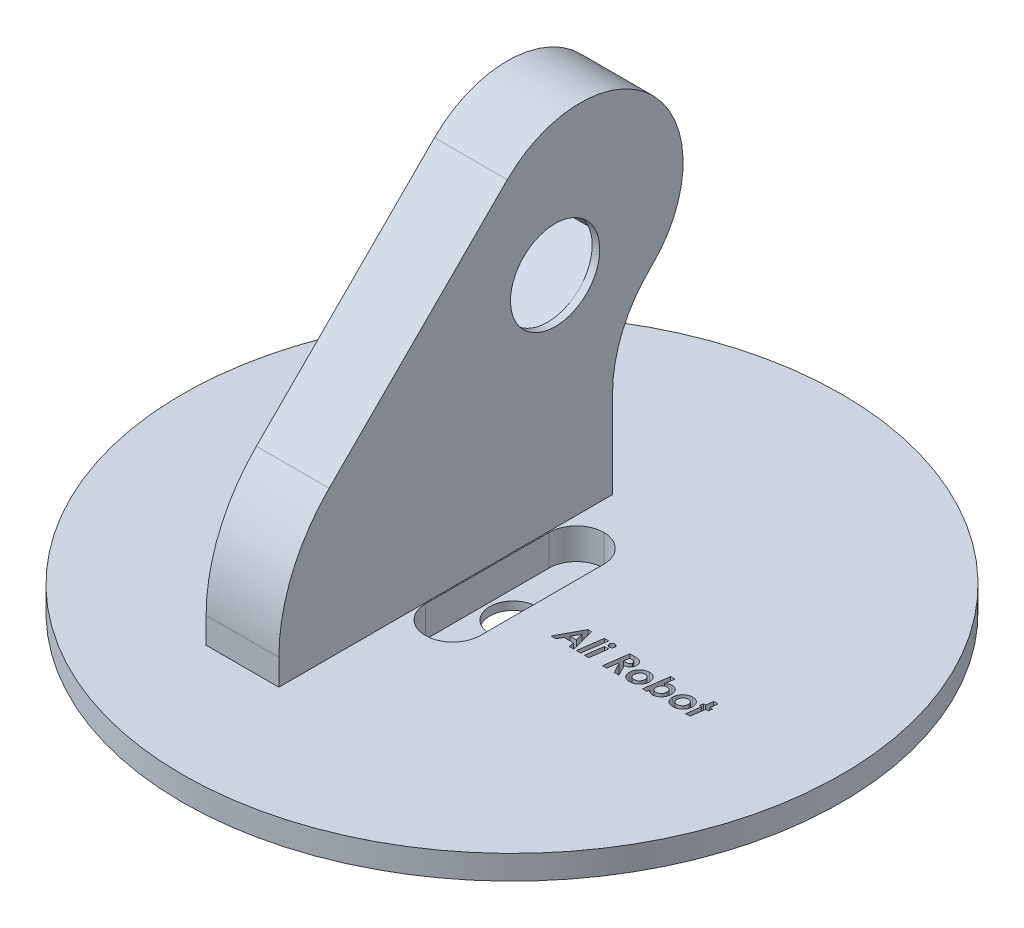
from build123d import *

# Parameters (mm, degrees)
SKETCH2_R           = 48
BOSS_EXTRUDE1_DEPTH = 3.5
BOSS_EXTRUDE2_DEPTH = 10.6
SKETCH31_R          = 6.5
CUT_EXTRUDE18_DEPTH = 94.671540859
CUT_EXTRUDE19_DEPTH = 9.5
SKETCH32_R          = 1
CUT_EXTRUDE20_DEPTH = 4.5
SKETCH33_R          = 42.5
BOSS_EXTRUDE3_DEPTH = 2.2
SKETCH34_W          = 8
SKETCH34_H          = 26
CUT_EXTRUDE21_DEPTH = 4.5
SKETCH35_R          = 3.43
CUT_EXTRUDE22_DEPTH = 136.699421377
FILLET1_R           = 4
SKETCH36_R          = 1
CUT_EXTRUDE23_DEPTH = 4.5
CUT_EXTRUDE24_DEPTH = 3


with BuildPart() as part:
    # Sketch2 → Boss-Extrude1 (new body)
    with BuildSketch(Plane(origin=(0, 0, 0), x_dir=(1, 0, 0), z_dir=(0, 1, 0))):
        with Locations(Location((0, 0, 0), (0, 0, 270))):
            Circle(SKETCH2_R)
    extrude(amount=BOSS_EXTRUDE1_DEPTH)

    # Sketch7 → Boss-Extrude2 (add)
    with BuildSketch(Plane(origin=(-4, 0, 0), x_dir=(0, 0, -1), z_dir=(1, 0, 0))):
        with BuildLine():
            Line((18.652115716, 3.5), (18.652115716, 16.356133126))
            ThreePointArc((18.652115716, 16.356133126), (20.111216245, 23.455333411), (24.251965127, 29.403595153))
            ThreePointArc((24.251965127, 29.403595153), (24.659117989, 50.747356958), (3.311904584, 50.883081894))
            Line((3.311904584, 50.883081894), (-22.631121669, 24.94005564))
            ThreePointArc((-22.631121669, 24.94005564), (-28.050440452, 16.82947192), (-29.95345214, 7.262386111))
            Line((-29.95345214, 7.262386111), (-29.95345214, 3.5))
            Line((-29.95345214, 3.5), (18.652115716, 3.5))
        make_face()
    extrude(amount=-BOSS_EXTRUDE2_DEPTH)

    # Sketch31 → Cut-Extrude18 (cut, through all)
    with BuildSketch(Plane(origin=(-14.6, 10.461755651, -5.359516796), x_dir=(0, 0, 1), z_dir=(-1, 0, 0))):
        with Locations((-4.922469695, 24.905412087)):
            Circle(SKETCH31_R)
    extrude(amount=-CUT_EXTRUDE18_DEPTH, mode=Mode.SUBTRACT)

    # Sketch31<3> → Cut-Extrude19 (cut)
    with BuildSketch(Plane(origin=(-14.6, 10.461755651, -5.359516796), x_dir=(0, 0, 1), z_dir=(-1, 0, 0))):
        Polygon((-5.41546104, 34.054639751), (11.74960782, 18.74580534), (3.09678837, 9.043809897), (-14.06828049, 24.352644308), align=None)
    extrude(amount=-CUT_EXTRUDE19_DEPTH, mode=Mode.SUBTRACT)

    # Sketch32 → Cut-Extrude20 (cut)
    with BuildSketch(Plane.ZY.offset(14.6)):
        with Locations((-17.080620038, 41.264504586)):
            Circle(SKETCH32_R)
        with Locations((3.929449654, 22.692559529)):
            Circle(SKETCH32_R)
    extrude(amount=-CUT_EXTRUDE20_DEPTH, mode=Mode.SUBTRACT)

    # Sketch33 → Boss-Extrude3 (add)
    with BuildSketch(Plane.XZ):
        with Locations(Location((0, 0, 0), (0, 0, 270))):
            Circle(SKETCH33_R)
    extrude(amount=BOSS_EXTRUDE3_DEPTH)

    # Sketch34 → Cut-Extrude21 (cut)
    with BuildSketch(Plane(origin=(-3.933328665, 3.5, 15.113921586), x_dir=(1, 0, 0), z_dir=(0, 1, 0))):
        with Locations((4.080604154, 15.353143489)):
            Rectangle(SKETCH34_W, SKETCH34_H)
    extrude(amount=-CUT_EXTRUDE21_DEPTH, mode=Mode.SUBTRACT)

    # Sketch35 → Cut-Extrude22 (cut, through all)
    with BuildSketch(Plane(origin=(64.920383929, 3.5, -6.612415768), x_dir=(1, 0, 0), z_dir=(0, 1, 0))):
        with Locations(Location((-64.816151671, -6.541004949, 0), (0, 0, 270))):
            Circle(SKETCH35_R)
    extrude(amount=-CUT_EXTRUDE22_DEPTH, mode=Mode.SUBTRACT)

    # Fillet1
    fillet1_edges = [part.edges().sort_by_distance(p)[0] for p in [
        (4.147275489, 1.25, 12.760778097),
        (-3.852724511, 1.25, 12.760778097),
        (4.147275489, 1.25, -13.239221903),
        (-3.852724511, 1.25, -13.239221903),
    ]]
    fillet(fillet1_edges, radius=FILLET1_R - 0.0001)  # a hair under: the kernel refuses the full size

    # Sketch36 → Cut-Extrude23 (cut)
    with BuildSketch(Plane(origin=(-0.364876774, -1, -0.231577183), x_dir=(1, 0, 0), z_dir=(0, 1, 0))):
        with Locations(Location((0.999824919, 5.746037209, 0), (0, 0, 270))):
            Circle(SKETCH36_R)
        with Locations(Location((0.996583401, -6.066660315, 0), (0, 0, 270))):
            Circle(SKETCH36_R)
    extrude(amount=-CUT_EXTRUDE23_DEPTH, mode=Mode.SUBTRACT)

    # Sketch38 → Cut-Extrude24 (cut)
    # profile 1 of 9: a face of its own
    with BuildSketch(Plane(origin=(0, 3.5, 0), x_dir=(1, 0, 0), z_dir=(0, 1, 0))):
        Polygon((11.234213374, -0.170104505), (11.785295104, -0.170104505), (12.673616419, -3.670104505), (12.027182124, -3.670104505), (11.833672508, -2.907283992), (10.469289496, -2.907283992), (10.059834367, -3.670104505), (9.353103598, -3.670104505), align=None)
        Polygon((11.684333566, -2.323950659), (11.395471387, -1.184627742), (10.78339206, -2.323950659), align=None, mode=Mode.SUBTRACT)
    # profile 2 of 9: a face of its own
    with BuildSketch(Plane(origin=(0, 3.5, 0), x_dir=(1, 0, 0), z_dir=(0, 1, 0))):
        Polygon((13.535996226, -0.080360915), (14.169810329, -0.080360915), (13.66640488, -3.670104505), (13.032590778, -3.670104505), align=None)
    # profile 3 of 9: a face of its own
    with BuildSketch(Plane(origin=(0, 3.5, 0), x_dir=(1, 0, 0), z_dir=(0, 1, 0))):
        with BuildLine():
            add(Edge.make_bspline(
                [(15.006949752, -0.03548912), (15.033724236, -0.037050399), (15.086317182, -0.040117209), (15.162584245, -0.062149233), (15.231434376, -0.101556531), (15.293403814, -0.152881213), (15.344728495, -0.21485065), (15.384135793, -0.283700781), (15.406167817, -0.359967844), (15.409234627, -0.41256079), (15.410795906, -0.439335274)],
                knots=[0, 0, 0, 0, 1.014134371, 1.992057583, 2.975098753, 4, 5.024901247, 6.007942417, 6.985865629, 8, 8, 8, 8], degree=3))
            add(Edge.make_bspline(
                [(15.410795906, -0.439335274), (15.409245272, -0.466115808), (15.406199373, -0.518720637), (15.383956784, -0.595099209), (15.344970591, -0.664433822), (15.29334378, -0.726417249), (15.231646153, -0.777958507), (15.162369408, -0.816365475), (15.086344614, -0.83860223), (15.03373349, -0.841636642), (15.006949752, -0.843181428)],
                knots=[0, 0, 0, 0, 1.013694729, 1.991193998, 2.981551723, 4.006008661, 5.030465598, 6.008806002, 6.986305271, 8, 8, 8, 8], degree=3))
            add(Edge.make_bspline(
                [(15.006949752, -0.843181428), (14.980160104, -0.841647208), (14.927537372, -0.83863355), (14.85139842, -0.816186723), (14.781641719, -0.77820039), (14.719927005, -0.726358021), (14.668084636, -0.664643307), (14.630098303, -0.594886606), (14.607651476, -0.518747654), (14.604637818, -0.466124922), (14.603103598, -0.439335274)],
                knots=[0, 0, 0, 0, 1.01324697, 1.990314468, 2.975995575, 4, 5.024004425, 6.009685532, 6.98675303, 8, 8, 8, 8], degree=3))
            add(Edge.make_bspline(
                [(14.603103598, -0.439335274), (14.604648384, -0.412551536), (14.607682796, -0.359940413), (14.629919552, -0.283915618), (14.668326519, -0.214638873), (14.719867777, -0.152941246), (14.781851204, -0.101314435), (14.851185818, -0.062328242), (14.927564389, -0.040085653), (14.980169218, -0.037039754), (15.006949752, -0.03548912)],
                knots=[0, 0, 0, 0, 1.013694729, 1.991193998, 2.969534402, 3.993991339, 5.018448277, 6.008806002, 6.986305271, 8, 8, 8, 8], degree=3))
        make_face()
    # profile 4 of 9: a face of its own
    with BuildSketch(Plane(origin=(0, 3.5, 0), x_dir=(1, 0, 0), z_dir=(0, 1, 0))):
        Polygon((14.562438534, -1.112412197), (15.196252637, -1.112412197), (14.833071547, -3.670104505), (14.199257444, -3.670104505), align=None)
    # profile 5 of 9: a face of its own
    with BuildSketch(Plane(origin=(0, 3.5, 0), x_dir=(1, 0, 0), z_dir=(0, 1, 0))):
        with BuildLine():
            Line((17.337478598, -0.170104505), (17.945351194, -0.170104505))
            add(Edge.make_bspline(
                [(17.945351194, -0.170104505), (17.990461912, -0.170288853), (18.0774408, -0.170644298), (18.20251927, -0.175698725), (18.317320027, -0.183324297), (18.421706567, -0.19338775), (18.515766042, -0.207350229), (18.599302851, -0.224114981), (18.672850562, -0.242784868), (18.716956864, -0.260134145), (18.737618822, -0.268261556)],
                knots=[0, 0, 0, 0, 1.348808202, 2.600664361, 3.742342956, 4.788858012, 5.735658768, 6.584006912, 7.336666444, 8, 8, 8, 8], degree=3))
            add(Edge.make_bspline(
                [(18.737618822, -0.268261556), (18.760881531, -0.278751926), (18.806356444, -0.29925894), (18.871519344, -0.334019586), (18.932539327, -0.371466236), (18.988405098, -0.413010751), (19.040295597, -0.456903826), (19.087889056, -0.503562941), (19.130802248, -0.55370417), (19.169485538, -0.606428163), (19.203882551, -0.661666729), (19.233408844, -0.719692265), (19.258939718, -0.780013512), (19.278877214, -0.843286871), (19.29544767, -0.908752815), (19.30616484, -0.97682439), (19.313707078, -1.04727198), (19.314326819, -1.095096686), (19.31464206, -1.119423415)],
                knots=[0, 0, 0, 0, 1.116361014, 2.182309107, 3.229450697, 4.24598407, 5.225421932, 6.201651319, 7.158895679, 8.110002388, 9.060669178, 10.002827475, 10.956240434, 11.923213192, 12.902917952, 13.908279153, 14.936015885, 16, 16, 16, 16], degree=3))
            add(Edge.make_bspline(
                [(19.31464206, -1.119423415), (19.313900694, -1.14935913), (19.312437117, -1.208457078), (19.302873802, -1.295604951), (19.285037031, -1.379232383), (19.261016279, -1.459602808), (19.231256497, -1.537236615), (19.192877363, -1.610782918), (19.148515858, -1.681523171), (19.097282847, -1.748529924), (19.040017621, -1.812417855), (18.973896349, -1.869427088), (18.902576953, -1.923391655), (18.823129531, -1.97069347), (18.737739084, -2.014632643), (18.644457977, -2.051860582), (18.545036949, -2.086216223), (18.475324737, -2.103410743), (18.43964206, -2.112211877)],
                knots=[0, 0, 0, 0, 0.995453645, 1.965186658, 2.910129054, 3.83459069, 4.752398018, 5.669942118, 6.588407184, 7.525617038, 8.471772905, 9.435289717, 10.423772802, 11.441988612, 12.505459691, 13.613754905, 14.778583949, 16, 16, 16, 16], degree=3))
            Line((18.43964206, -2.112211877), (19.247334367, -3.670104505))
            Line((19.247334367, -3.670104505), (18.545511451, -3.670104505))
            Line((18.545511451, -3.670104505), (17.754646066, -2.144463479))
            Line((17.754646066, -2.144463479), (17.695050713, -2.144463479))
            Line((17.695050713, -2.144463479), (17.480507444, -3.670104505))
            Line((17.480507444, -3.670104505), (16.846693342, -3.670104505))
            Line((16.846693342, -3.670104505), (17.337478598, -0.170104505))
        make_face()
        with BuildLine():
            add(Edge.make_bspline(
                [(17.777081963, -1.561130146), (17.822194038, -1.560711256), (17.908482086, -1.559910025), (18.031718476, -1.554336883), (18.14284927, -1.545533343), (18.241553965, -1.532952509), (18.328092207, -1.518073936), (18.40209638, -1.499499099), (18.463905682, -1.477413957), (18.514495006, -1.451223183), (18.555475842, -1.42047266), (18.590946517, -1.387657032), (18.620482235, -1.350923569), (18.644851849, -1.31088895), (18.66364733, -1.267470195), (18.677201777, -1.220373146), (18.684696139, -1.16991183), (18.685848236, -1.135105351), (18.686436931, -1.11732005)],
                knots=[0, 0, 0, 0, 1.892208387, 3.619318591, 5.173427176, 6.566868293, 7.791773198, 8.8545744, 9.763297566, 10.539470204, 11.233547833, 11.906251103, 12.5615143, 13.203742025, 13.866659999, 14.539934446, 15.25394049, 16, 16, 16, 16], degree=3))
            add(Edge.make_bspline(
                [(18.686436931, -1.11732005), (18.685674889, -1.097154087), (18.68419663, -1.058034883), (18.671410296, -1.001691948), (18.649546106, -0.950581254), (18.618818966, -0.905191441), (18.580473147, -0.865168951), (18.53369335, -0.832205814), (18.479014112, -0.806257483), (18.427792709, -0.789114207), (18.379308966, -0.779184383), (18.334112776, -0.772512871), (18.280601749, -0.7660751), (18.218614928, -0.761314571), (18.148226827, -0.75816557), (18.069473284, -0.755105638), (17.982513177, -0.754017509), (17.921746603, -0.753636911), (17.889962572, -0.753437838)],
                knots=[0, 0, 0, 0, 0.974340854, 1.890087692, 2.776057671, 3.647490651, 4.526730822, 5.442477659, 6.397820337, 7.445016909, 8.045730266, 8.789007992, 9.653967296, 10.651691253, 11.794598421, 13.061237498, 14.462876682, 16, 16, 16, 16], degree=3))
            Line((17.889962572, -0.753437838), (17.777081963, -1.561130146))
        make_face(mode=Mode.SUBTRACT)
    # profile 6 of 9: a face of its own
    with BuildSketch(Plane(origin=(0, 3.5, 0), x_dir=(1, 0, 0), z_dir=(0, 1, 0))):
        with BuildLine():
            add(Edge.make_bspline(
                [(21.10390488, -1.067540402), (21.132205676, -1.067801263), (21.188216739, -1.068317542), (21.271251688, -1.076791941), (21.352561402, -1.088283547), (21.431755309, -1.105087467), (21.508763418, -1.127042832), (21.583911738, -1.1537877), (21.657385991, -1.185052775), (21.728169586, -1.221737771), (21.79620025, -1.2622808), (21.860854534, -1.306994684), (21.921055687, -1.356524279), (21.978491813, -1.408937638), (22.030743266, -1.466611664), (22.079230459, -1.527904512), (22.124539495, -1.592781526), (22.16560308, -1.661642395), (22.201764854, -1.734065485), (22.234420935, -1.808192303), (22.261103392, -1.885165214), (22.28235286, -1.964249823), (22.30065848, -2.045266898), (22.311711934, -2.128584003), (22.320319088, -2.213929685), (22.32080558, -2.271576635), (22.321052316, -2.30081364)],
                knots=[0, 0, 0, 0, 1.048380346, 2.074885017, 3.090367486, 4.090964834, 5.072523792, 6.056029873, 7.045505985, 8.029469653, 9.008388104, 9.979110116, 10.939576094, 11.895736256, 12.858269977, 13.820062943, 14.790784955, 15.789017664, 16.788414625, 17.789274365, 18.789121639, 19.804049856, 20.823403653, 21.864603227, 22.916983403, 24, 24, 24, 24], degree=3))
            add(Edge.make_bspline(
                [(22.321052316, -2.30081364), (22.319619601, -2.349019816), (22.316797746, -2.443966047), (22.297012332, -2.583639323), (22.263197648, -2.71753656), (22.215858626, -2.846045115), (22.155304616, -2.969198555), (22.081284251, -3.087107245), (21.992933579, -3.198542586), (21.893318647, -3.303762939), (21.784010872, -3.400153265), (21.666804377, -3.484466244), (21.543203881, -3.555740679), (21.413517543, -3.614546208), (21.276800052, -3.659246415), (21.134065161, -3.691262002), (20.985073188, -3.711747396), (20.883586993, -3.71388631), (20.831869624, -3.7149763)],
                knots=[0, 0, 0, 0, 1.011104245, 1.991457176, 2.952197104, 3.902991464, 4.858928698, 5.826026836, 6.817568841, 7.837123857, 8.861887107, 9.870051414, 10.860623363, 11.850212162, 12.851715058, 13.872153699, 14.915649431, 16, 16, 16, 16], degree=3))
            add(Edge.make_bspline(
                [(20.831869624, -3.7149763), (20.787180608, -3.714153797), (20.699859256, -3.712546645), (20.572535065, -3.696510448), (20.451951023, -3.671832677), (20.338440225, -3.635615998), (20.231550643, -3.590365048), (20.131718852, -3.534302422), (20.038690652, -3.468474255), (19.954355691, -3.391708196), (19.877584733, -3.307755196), (19.811040754, -3.216412915), (19.75412752, -3.118885549), (19.708910665, -3.014632036), (19.672882858, -2.904560186), (19.647014793, -2.788376728), (19.631256388, -2.665832705), (19.629593856, -2.582011467), (19.628744624, -2.53919505)],
                knots=[0, 0, 0, 0, 1.130534475, 2.209039425, 3.242686211, 4.241648197, 5.219495055, 6.175504508, 7.134035888, 8.097337106, 9.056251676, 10.008649417, 10.952170628, 11.908308165, 12.879116703, 13.879338768, 14.916752852, 16, 16, 16, 16], degree=3))
            add(Edge.make_bspline(
                [(19.628744624, -2.53919505), (19.630129394, -2.487484152), (19.63285354, -2.385757449), (19.653222978, -2.236445943), (19.688511473, -2.094173346), (19.737255381, -1.958685096), (19.798811542, -1.829343138), (19.876295949, -1.707787872), (19.966196952, -1.592038304), (20.069660962, -1.485284387), (20.181690912, -1.387899142), (20.299281022, -1.301752877), (20.422559058, -1.230100692), (20.549460565, -1.169585046), (20.682121593, -1.124371206), (20.818625267, -1.091170449), (20.959799348, -1.070900032), (21.055460923, -1.068669809), (21.10390488, -1.067540402)],
                knots=[0, 0, 0, 0, 1.070407058, 2.105725986, 3.11260329, 4.099768105, 5.082273654, 6.071629737, 7.078227986, 8.111679688, 9.144009435, 10.148605521, 11.124500349, 12.092034995, 13.054511379, 14.020338642, 14.997480131, 16, 16, 16, 16], degree=3))
        make_face()
        with BuildLine():
            add(Edge.make_bspline(
                [(21.057630842, -1.650873736), (21.026269955, -1.651636447), (20.965150904, -1.653122889), (20.876302302, -1.665982872), (20.79304741, -1.686932574), (20.715073471, -1.716261753), (20.643419269, -1.755392612), (20.576507562, -1.801790198), (20.516281479, -1.857752454), (20.462012486, -1.920664044), (20.414176698, -1.988504559), (20.372137329, -2.058299005), (20.336555272, -2.129766087), (20.308269609, -2.202725024), (20.284359334, -2.276698707), (20.268472408, -2.352366514), (20.259260913, -2.429591807), (20.257725534, -2.481444774), (20.256949752, -2.507644569)],
                knots=[0, 0, 0, 0, 1.147646984, 2.236642535, 3.278363253, 4.285788599, 5.277283386, 6.259990092, 7.25913394, 8.278119336, 9.296601724, 10.294389209, 11.258634566, 12.215104854, 13.156804447, 14.101569642, 15.040778374, 16, 16, 16, 16], degree=3))
            add(Edge.make_bspline(
                [(20.256949752, -2.507644569), (20.257532631, -2.530566622), (20.258672044, -2.575374643), (20.26627562, -2.640906789), (20.279776611, -2.702779036), (20.297767954, -2.76144146), (20.321967792, -2.816579396), (20.351167991, -2.868405184), (20.386215923, -2.916407622), (20.424970871, -2.961466715), (20.469417067, -3.001175849), (20.516988562, -3.036297243), (20.568043814, -3.066353198), (20.623114972, -3.08986505), (20.681451247, -3.109062165), (20.743278336, -3.12217512), (20.808531786, -3.129982068), (20.853114676, -3.131078932), (20.876040297, -3.131642967)],
                knots=[0, 0, 0, 0, 1.110133544, 2.170088686, 3.189065258, 4.17351184, 5.136579884, 6.099647928, 7.048308506, 8.010844321, 8.972448026, 9.927769731, 10.871216919, 11.834284962, 12.822174017, 13.841150589, 14.889866456, 16, 16, 16, 16], degree=3))
            add(Edge.make_bspline(
                [(20.876040297, -3.131642967), (20.908327519, -3.13081147), (20.971260249, -3.129190756), (21.062683434, -3.117309576), (21.148088828, -3.097133982), (21.227451551, -3.068248614), (21.300688371, -3.030725324), (21.368699859, -2.985891305), (21.429944961, -2.931876311), (21.48509304, -2.870934664), (21.533550481, -2.804751067), (21.575853609, -2.735370924), (21.612525236, -2.664120492), (21.642112388, -2.59018004), (21.664496143, -2.514049921), (21.680676275, -2.435740061), (21.690718735, -2.355059531), (21.692133156, -2.300374861), (21.692847188, -2.272768768)],
                knots=[0, 0, 0, 0, 1.164111062, 2.269030304, 3.317651816, 4.322802953, 5.30652745, 6.278887004, 7.252451034, 8.242831511, 9.237327035, 10.205734188, 11.170614506, 12.123681709, 13.072978069, 14.028315502, 15.004647829, 16, 16, 16, 16], degree=3))
            add(Edge.make_bspline(
                [(21.692847188, -2.272768768), (21.692320588, -2.250308024), (21.691285496, -2.206158886), (21.68279286, -2.141566002), (21.668601759, -2.080413151), (21.649936064, -2.022074887), (21.624294897, -1.967648418), (21.59433855, -1.915645637), (21.557203679, -1.868141891), (21.516160513, -1.823345671), (21.47081675, -1.782623151), (21.42121727, -1.747521842), (21.368893834, -1.71708776), (21.312660418, -1.693288489), (21.253512837, -1.674378403), (21.19119306, -1.66009748), (21.125354829, -1.652631844), (21.080550835, -1.651468737), (21.057630842, -1.650873736)],
                knots=[0, 0, 0, 0, 1.079193067, 2.121276228, 3.123935011, 4.093589047, 5.058482656, 6.010079462, 6.971567708, 7.949254825, 8.927715837, 9.893916005, 10.864935156, 11.830939453, 12.821955205, 13.846519011, 14.898362312, 16, 16, 16, 16], degree=3))
        make_face(mode=Mode.SUBTRACT)
    # profile 7 of 9: a face of its own
    with BuildSketch(Plane(origin=(0, 3.5, 0), x_dir=(1, 0, 0), z_dir=(0, 1, 0))):
        with BuildLine():
            Line((23.313840778, -3.670104505), (22.680026675, -3.670104505))
            Line((22.680026675, -3.670104505), (23.183432124, -0.080360915))
            Line((23.183432124, -0.080360915), (23.816545104, -0.080360915))
            Line((23.816545104, -0.080360915), (23.62724222, -1.431422614))
            add(Edge.make_bspline(
                [(23.62724222, -1.431422614), (23.660177044, -1.399109951), (23.722878643, -1.337592827), (23.819913625, -1.257983779), (23.913193306, -1.193936975), (24.005187179, -1.145305221), (24.098742939, -1.110612562), (24.195640627, -1.085114674), (24.298223302, -1.070244068), (24.368279889, -1.068454853), (24.404085169, -1.067540402)],
                knots=[0, 0, 0, 0, 1.251006972, 2.381677804, 3.399685655, 4.315539795, 5.196231247, 6.100316428, 7.029089122, 8, 8, 8, 8], degree=3))
            add(Edge.make_bspline(
                [(24.404085169, -1.067540402), (24.445287674, -1.068485671), (24.525749337, -1.070331624), (24.643204002, -1.088646533), (24.754232376, -1.117047879), (24.859019208, -1.15696827), (24.956475295, -1.209814729), (25.048312142, -1.272826908), (25.132725115, -1.348770844), (25.209846362, -1.434799464), (25.27933836, -1.527884039), (25.33968521, -1.62604411), (25.392255494, -1.727123958), (25.434281606, -1.832633065), (25.466552847, -1.941835417), (25.48961194, -2.054416651), (25.504092748, -2.170730285), (25.505988174, -2.249589314), (25.506949752, -2.289595691)],
                knots=[0, 0, 0, 0, 1.074461769, 2.098245705, 3.093738161, 4.060957578, 5.015928931, 5.980202173, 6.960712075, 7.971130566, 8.990819314, 9.98765587, 10.975026468, 11.960285364, 12.946317818, 13.942631884, 14.956266082, 16, 16, 16, 16], degree=3))
            add(Edge.make_bspline(
                [(25.506949752, -2.289595691), (25.506485439, -2.320470332), (25.505561779, -2.381889453), (25.495813586, -2.473415201), (25.4813639, -2.564117418), (25.460305544, -2.653867108), (25.432779537, -2.742293146), (25.399567925, -2.82953584), (25.361221982, -2.915948082), (25.316298398, -3.000256141), (25.266843562, -3.082073165), (25.212840452, -3.159694669), (25.155387397, -3.233294504), (25.092786476, -3.301015233), (25.02655498, -3.364505202), (24.956494381, -3.423572461), (24.881754013, -3.47756321), (24.803840208, -3.527078419), (24.723179042, -3.57113124), (24.641359309, -3.609869553), (24.558288967, -3.6420021), (24.474837248, -3.668999362), (24.390386293, -3.689199505), (24.305160276, -3.703946802), (24.218975194, -3.713542499), (24.161054574, -3.714497878), (24.132049912, -3.7149763)],
                knots=[0, 0, 0, 0, 1.013451801, 2.016066107, 3.019062145, 4.027971124, 5.040172772, 6.057828882, 7.091818133, 8.14227902, 9.192543668, 10.229263228, 11.245616414, 12.255867067, 13.254567598, 14.256800029, 15.26222985, 16.27988596, 17.286164752, 18.278298122, 19.250221527, 20.208875209, 21.15628221, 22.098734397, 23.047911355, 24, 24, 24, 24], degree=3))
            add(Edge.make_bspline(
                [(24.132049912, -3.7149763), (24.093171265, -3.713587548), (24.016277583, -3.710840893), (23.903498917, -3.690228625), (23.79579298, -3.655262854), (23.693309546, -3.607746487), (23.597518856, -3.546982021), (23.511655579, -3.471759408), (23.432370037, -3.386507872), (23.389570427, -3.320715947), (23.367827156, -3.287292005)],
                knots=[0, 0, 0, 0, 1.017645626, 2.01268628, 2.989956243, 3.975524875, 4.963465289, 5.948444836, 6.95775873, 8, 8, 8, 8], degree=3))
            Line((23.367827156, -3.287292005), (23.313840778, -3.670104505))
        make_face()
        with BuildLine():
            add(Edge.make_bspline(
                [(24.265263053, -1.650873736), (24.228968933, -1.652102616), (24.158238745, -1.654497465), (24.055407816, -1.672667991), (23.960088703, -1.704745444), (23.871134011, -1.748066448), (23.790345373, -1.806273578), (23.715653776, -1.877031365), (23.649507263, -1.963123617), (23.590054465, -2.059494251), (23.541668223, -2.163617884), (23.505225164, -2.270612742), (23.483457468, -2.379392755), (23.480684848, -2.452396344), (23.479305521, -2.488714281)],
                knots=[0, 0, 0, 0, 1.020631644, 1.989012793, 2.92445932, 3.841689372, 4.76099003, 5.714169008, 6.725443104, 7.805523698, 8.893656079, 9.947594549, 10.978966212, 12, 12, 12, 12], degree=3))
            add(Edge.make_bspline(
                [(23.479305521, -2.488714281), (23.479880618, -2.512339552), (23.481005486, -2.558549754), (23.488729431, -2.626136473), (23.501772501, -2.690088284), (23.52120186, -2.750219249), (23.544746002, -2.807313215), (23.574290204, -2.860601683), (23.609165582, -2.910337835), (23.648779905, -2.956220431), (23.692954796, -2.997921983), (23.741494491, -3.033429202), (23.793008881, -3.064116944), (23.848068499, -3.088256666), (23.905962492, -3.108722547), (23.967819684, -3.121165115), (24.032692366, -3.130219437), (24.077094213, -3.131161341), (24.09979831, -3.131642967)],
                knots=[0, 0, 0, 0, 1.126186038, 2.20278045, 3.238531955, 4.232199798, 5.210951865, 6.178414309, 7.130420157, 8.102043749, 9.063714879, 10.019689469, 10.96364203, 11.916169311, 12.881576601, 13.884632073, 14.918344105, 16, 16, 16, 16], degree=3))
            add(Edge.make_bspline(
                [(24.09979831, -3.131642967), (24.126486516, -3.131068206), (24.178941073, -3.129938537), (24.255911966, -3.118063791), (24.330043349, -3.100131687), (24.400958776, -3.074004662), (24.468729446, -3.040689075), (24.533661769, -3.000757277), (24.594945241, -2.952450746), (24.652597178, -2.897439839), (24.705687784, -2.836877111), (24.752381551, -2.771554995), (24.791000144, -2.701195744), (24.82348501, -2.627193526), (24.847714734, -2.548490868), (24.86639777, -2.466085248), (24.87672908, -2.379136017), (24.878065423, -2.319769131), (24.878744624, -2.289595691)],
                knots=[0, 0, 0, 0, 0.998366777, 1.962248238, 2.9086585, 3.849756023, 4.784937843, 5.731833278, 6.697935849, 7.700472628, 8.711184204, 9.708937404, 10.699800307, 11.710776929, 12.729071636, 13.777697986, 14.87050675, 16, 16, 16, 16], degree=3))
            add(Edge.make_bspline(
                [(24.878744624, -2.289595691), (24.878166027, -2.266205274), (24.877034532, -2.220463372), (24.869363374, -2.153555367), (24.85608738, -2.090150181), (24.837192797, -2.030183276), (24.812400245, -1.97397123), (24.782987899, -1.920860313), (24.74762681, -1.87173701), (24.707682685, -1.826223703), (24.663776511, -1.784799273), (24.615888899, -1.749077356), (24.565052455, -1.718418003), (24.510699896, -1.694240055), (24.453915097, -1.674028431), (24.393539086, -1.661235902), (24.330498066, -1.652349873), (24.287264398, -1.651371582), (24.265263053, -1.650873736)],
                knots=[0, 0, 0, 0, 1.12759846, 2.205112442, 3.24149039, 4.246337781, 5.230184043, 6.198685213, 7.167907017, 8.141962875, 9.114453566, 10.072146408, 11.017028515, 11.970004121, 12.93561737, 13.916944341, 14.939945928, 16, 16, 16, 16], degree=3))
        make_face(mode=Mode.SUBTRACT)
    # profile 8 of 9: a face of its own
    with BuildSketch(Plane(origin=(0, 3.5, 0), x_dir=(1, 0, 0), z_dir=(0, 1, 0))):
        with BuildLine():
            add(Edge.make_bspline(
                [(27.385956162, -1.067540402), (27.414256958, -1.067801263), (27.470268021, -1.068317542), (27.55330297, -1.076791941), (27.634612684, -1.088283547), (27.713806591, -1.105087467), (27.7908147, -1.127042832), (27.86596302, -1.1537877), (27.939437273, -1.185052775), (28.010220868, -1.221737771), (28.078251532, -1.2622808), (28.142905816, -1.306994684), (28.203106969, -1.356524279), (28.260543095, -1.408937638), (28.312794548, -1.466611664), (28.361281741, -1.527904512), (28.406590777, -1.592781526), (28.447654362, -1.661642395), (28.483816136, -1.734065485), (28.516472217, -1.808192303), (28.543154674, -1.885165214), (28.564404142, -1.964249823), (28.582709762, -2.045266898), (28.593763216, -2.128584003), (28.60237037, -2.213929685), (28.602856862, -2.271576635), (28.603103598, -2.30081364)],
                knots=[0, 0, 0, 0, 1.048380346, 2.074885017, 3.090367486, 4.090964834, 5.072523792, 6.056029873, 7.045505985, 8.029469653, 9.008388104, 9.979110116, 10.939576094, 11.895736256, 12.858269977, 13.820062943, 14.790784955, 15.789017664, 16.788414625, 17.789274365, 18.789121639, 19.804049856, 20.823403653, 21.864603227, 22.916983403, 24, 24, 24, 24], degree=3))
            add(Edge.make_bspline(
                [(28.603103598, -2.30081364), (28.601670883, -2.349019816), (28.598849028, -2.443966047), (28.579063614, -2.583639323), (28.54524893, -2.71753656), (28.497909908, -2.846045115), (28.437355898, -2.969198555), (28.363335533, -3.087107245), (28.274984861, -3.198542586), (28.175369929, -3.303762939), (28.066062154, -3.400153265), (27.948855659, -3.484466244), (27.825255163, -3.555740679), (27.695568825, -3.614546208), (27.558851334, -3.659246415), (27.416116443, -3.691262002), (27.26712447, -3.711747396), (27.165638275, -3.71388631), (27.113920906, -3.7149763)],
                knots=[0, 0, 0, 0, 1.011104245, 1.991457176, 2.952197104, 3.902991464, 4.858928698, 5.826026836, 6.817568841, 7.837123857, 8.861887107, 9.870051414, 10.860623363, 11.850212162, 12.851715058, 13.872153699, 14.915649431, 16, 16, 16, 16], degree=3))
            add(Edge.make_bspline(
                [(27.113920906, -3.7149763), (27.06923189, -3.714153797), (26.981910538, -3.712546645), (26.854586347, -3.696510448), (26.734002305, -3.671832677), (26.620491507, -3.635615998), (26.513601925, -3.590365048), (26.413770134, -3.534302422), (26.320741934, -3.468474255), (26.236406974, -3.391708196), (26.159636015, -3.307755196), (26.093092036, -3.216412915), (26.036178802, -3.118885549), (25.990961947, -3.014632036), (25.95493414, -2.904560186), (25.929066075, -2.788376728), (25.913307671, -2.665832705), (25.911645138, -2.582011467), (25.910795906, -2.53919505)],
                knots=[0, 0, 0, 0, 1.130534475, 2.209039425, 3.242686211, 4.241648197, 5.219495055, 6.175504508, 7.134035888, 8.097337106, 9.056251676, 10.008649417, 10.952170628, 11.908308165, 12.879116703, 13.879338768, 14.916752852, 16, 16, 16, 16], degree=3))
            add(Edge.make_bspline(
                [(25.910795906, -2.53919505), (25.912180676, -2.487484152), (25.914904822, -2.385757449), (25.93527426, -2.236445943), (25.970562755, -2.094173346), (26.019306663, -1.958685096), (26.080862824, -1.829343138), (26.158347231, -1.707787872), (26.248248234, -1.592038304), (26.351712244, -1.485284387), (26.463742194, -1.387899142), (26.581332304, -1.301752877), (26.70461034, -1.230100692), (26.831511847, -1.169585046), (26.964172875, -1.124371206), (27.100676549, -1.091170449), (27.24185063, -1.070900032), (27.337512205, -1.068669809), (27.385956162, -1.067540402)],
                knots=[0, 0, 0, 0, 1.070407058, 2.105725986, 3.11260329, 4.099768105, 5.082273654, 6.071629737, 7.078227986, 8.111679688, 9.144009435, 10.148605521, 11.124500349, 12.092034995, 13.054511379, 14.020338642, 14.997480131, 16, 16, 16, 16], degree=3))
        make_face()
        with BuildLine():
            add(Edge.make_bspline(
                [(27.339682124, -1.650873736), (27.308321237, -1.651636447), (27.247202186, -1.653122889), (27.158353584, -1.665982872), (27.075098692, -1.686932574), (26.997124753, -1.716261753), (26.925470551, -1.755392612), (26.858558844, -1.801790198), (26.798332761, -1.857752454), (26.744063768, -1.920664044), (26.69622798, -1.988504559), (26.654188611, -2.058299005), (26.618606554, -2.129766087), (26.590320891, -2.202725024), (26.566410616, -2.276698707), (26.55052369, -2.352366514), (26.541312195, -2.429591807), (26.539776816, -2.481444774), (26.539001034, -2.507644569)],
                knots=[0, 0, 0, 0, 1.147646984, 2.236642535, 3.278363253, 4.285788599, 5.277283386, 6.259990092, 7.25913394, 8.278119336, 9.296601724, 10.294389209, 11.258634566, 12.215104854, 13.156804447, 14.101569642, 15.040778374, 16, 16, 16, 16], degree=3))
            add(Edge.make_bspline(
                [(26.539001034, -2.507644569), (26.539583913, -2.530566622), (26.540723326, -2.575374643), (26.548326902, -2.640906789), (26.561827893, -2.702779036), (26.579819236, -2.76144146), (26.604019074, -2.816579396), (26.633219273, -2.868405184), (26.668267205, -2.916407622), (26.707022153, -2.961466715), (26.751468349, -3.001175849), (26.799039844, -3.036297243), (26.850095096, -3.066353198), (26.905166254, -3.08986505), (26.963502529, -3.109062165), (27.025329618, -3.12217512), (27.090583068, -3.129982068), (27.135165958, -3.131078932), (27.158091579, -3.131642967)],
                knots=[0, 0, 0, 0, 1.110133544, 2.170088686, 3.189065258, 4.17351184, 5.136579884, 6.099647928, 7.048308506, 8.010844321, 8.972448026, 9.927769731, 10.871216919, 11.834284962, 12.822174017, 13.841150589, 14.889866456, 16, 16, 16, 16], degree=3))
            add(Edge.make_bspline(
                [(27.158091579, -3.131642967), (27.190378801, -3.13081147), (27.253311531, -3.129190756), (27.344734716, -3.117309576), (27.43014011, -3.097133982), (27.509502833, -3.068248614), (27.582739653, -3.030725324), (27.650751141, -2.985891305), (27.711996243, -2.931876311), (27.767144322, -2.870934664), (27.815601763, -2.804751067), (27.857904891, -2.735370924), (27.894576518, -2.664120492), (27.92416367, -2.59018004), (27.946547425, -2.514049921), (27.962727557, -2.435740061), (27.972770017, -2.355059531), (27.974184438, -2.300374861), (27.97489847, -2.272768768)],
                knots=[0, 0, 0, 0, 1.164111062, 2.269030304, 3.317651816, 4.322802953, 5.30652745, 6.278887004, 7.252451034, 8.242831511, 9.237327035, 10.205734188, 11.170614506, 12.123681709, 13.072978069, 14.028315502, 15.004647829, 16, 16, 16, 16], degree=3))
            add(Edge.make_bspline(
                [(27.97489847, -2.272768768), (27.97437187, -2.250308024), (27.973336778, -2.206158886), (27.964844142, -2.141566002), (27.950653041, -2.080413151), (27.931987347, -2.022074887), (27.906346179, -1.967648418), (27.876389832, -1.915645637), (27.839254961, -1.868141891), (27.798211795, -1.823345671), (27.752868032, -1.782623151), (27.703268552, -1.747521842), (27.650945116, -1.71708776), (27.5947117, -1.693288489), (27.535564119, -1.674378403), (27.473244342, -1.66009748), (27.407406111, -1.652631844), (27.362602117, -1.651468737), (27.339682124, -1.650873736)],
                knots=[0, 0, 0, 0, 1.079193067, 2.121276228, 3.123935011, 4.093589047, 5.058482656, 6.010079462, 6.971567708, 7.949254825, 8.927715837, 9.893916005, 10.864935156, 11.830939453, 12.821955205, 13.846519011, 14.898362312, 16, 16, 16, 16], degree=3))
        make_face(mode=Mode.SUBTRACT)
    # profile 9 of 9: a face of its own
    with BuildSketch(Plane(origin=(0, 3.5, 0), x_dir=(1, 0, 0), z_dir=(0, 1, 0))):
        Polygon((29.459874431, -0.080360915), (30.092987412, -0.080360915), (29.949958566, -1.112412197), (30.350299111, -1.112412197), (30.274577957, -1.650873736), (29.874938534, -1.650873736), (29.595190938, -3.670104505), (28.962077957, -3.670104505), (29.241825553, -1.650873736), (28.93192972, -1.650873736), (29.004846387, -1.112412197), (29.316845585, -1.112412197), align=None)
    extrude(amount=-CUT_EXTRUDE24_DEPTH, mode=Mode.SUBTRACT)


solid = part.part
